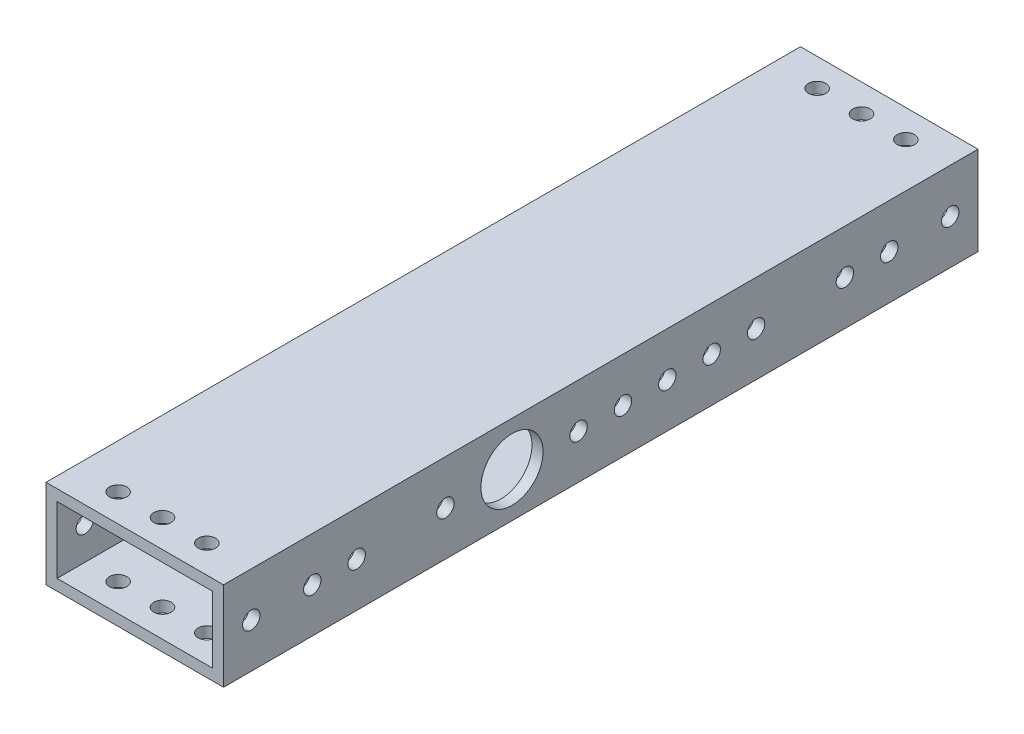
from build123d import *

# Parameters (mm, degrees)
SKETCH1_W           = 50.8
SKETCH1_H           = 25.4
SKETCH1_W_2         = 44.45
SKETCH1_H_2         = 19.05
BOSS_EXTRUDE1_DEPTH = 107.95
SKETCH3_R           = 2.4892
CUT_EXTRUDE2_DEPTH  = 114.769602707
SKETCH4_R           = 8.89
SKETCH4_R_2         = 2.4892
CUT_EXTRUDE3_DEPTH  = 120.979717036
SKETCH2_R           = 2.4892
CUT_EXTRUDE1_DEPTH  = 120.979717036
CUT_EXTRUDE4_REACH  = 115.77
SKETCH5_R           = 2.4892
CUT_EXTRUDE5_REACH  = 121.98
SKETCH7_R           = 2.4892


with BuildPart() as part:
    # Sketch1 → Boss-Extrude1 (new, symmetric)
    with BuildSketch(Plane.XY):
        Rectangle(SKETCH1_W, SKETCH1_H)
        Rectangle(SKETCH1_W_2, SKETCH1_H_2, mode=Mode.SUBTRACT)
    extrude(amount=BOSS_EXTRUDE1_DEPTH, both=True)

    # Sketch3 → Cut-Extrude2 (cut, through all)
    with BuildSketch(Plane(origin=(0, 12.7, 0), x_dir=(1, 0, 0), z_dir=(0, 1, 0))):
        with Locations((-12.7, -100.0125)):
            Circle(SKETCH3_R)
        with Locations((0, -100.0125)):
            Circle(SKETCH3_R)
        with Locations((12.7, -100.0125)):
            Circle(SKETCH3_R)
        with Locations((12.7, 100.0125)):
            Circle(SKETCH3_R)
        with Locations((0, 100.0125)):
            Circle(SKETCH3_R)
        with Locations((-12.7, 100.0125)):
            Circle(SKETCH3_R)
    extrude(amount=-CUT_EXTRUDE2_DEPTH, mode=Mode.SUBTRACT)

    # Sketch4 → Cut-Extrude3 (cut, through all)
    with BuildSketch(Plane(origin=(25.4, 0, 0), x_dir=(0, 0, -1), z_dir=(1, 0, 0))):
        with Locations((-25.4, 0)):
            Circle(SKETCH4_R)
        with Locations((31.75, 0)):
            Circle(SKETCH4_R_2)
        with Locations((19.05, 0)):
            Circle(SKETCH4_R_2)
    extrude(amount=-CUT_EXTRUDE3_DEPTH, mode=Mode.SUBTRACT)

    # Sketch2 → Cut-Extrude1 (cut, through all)
    with BuildSketch(Plane(origin=(25.4, 0, 0), x_dir=(0, 0, -1), z_dir=(1, 0, 0))):
        with Locations((-100.0125, 0)):
            Circle(SKETCH2_R)
        with Locations((100.0125, 0)):
            Circle(SKETCH2_R)
        with Locations((-82.55, 0)):
            Circle(SKETCH2_R)
        with Locations((-69.85, 0)):
            Circle(SKETCH2_R)
        with Locations((69.85, 0)):
            Circle(SKETCH2_R)
        with Locations((82.55, 0)):
            Circle(SKETCH2_R)
    extrude(amount=-CUT_EXTRUDE1_DEPTH, mode=Mode.SUBTRACT)

    # Sketch5 → Cut-Extrude4 (cut, up to next)
    with BuildSketch(Plane.XZ.offset(12.7), mode=Mode.PRIVATE) as cut_extrude4_sk1:
        with Locations((-3.81, 69.85)):
            Circle(SKETCH5_R)
    cut_extrude4_tool1 = extrude(cut_extrude4_sk1.sketch, amount=-CUT_EXTRUDE4_REACH, mode=Mode.PRIVATE) & part.part
    # Sketch5 → Cut-Extrude4 (cut, up to next)
    with BuildSketch(Plane.XZ.offset(12.7), mode=Mode.PRIVATE) as cut_extrude4_sk2:
        with Locations((-16.51, 69.85)):
            Circle(SKETCH5_R)
    cut_extrude4_tool2 = extrude(cut_extrude4_sk2.sketch, amount=-CUT_EXTRUDE4_REACH, mode=Mode.PRIVATE) & part.part
    # Sketch5 → Cut-Extrude4 (cut, up to next)
    with BuildSketch(Plane.XZ.offset(12.7), mode=Mode.PRIVATE) as cut_extrude4_sk3:
        with Locations((-16.51, 57.15)):
            Circle(SKETCH5_R)
    cut_extrude4_tool3 = extrude(cut_extrude4_sk3.sketch, amount=-CUT_EXTRUDE4_REACH, mode=Mode.PRIVATE) & part.part
    # Sketch5 → Cut-Extrude4 (cut, up to next)
    with BuildSketch(Plane.XZ.offset(12.7), mode=Mode.PRIVATE) as cut_extrude4_sk4:
        with Locations((-3.81, 57.15)):
            Circle(SKETCH5_R)
    cut_extrude4_tool4 = extrude(cut_extrude4_sk4.sketch, amount=-CUT_EXTRUDE4_REACH, mode=Mode.PRIVATE) & part.part
    # Sketch5 → Cut-Extrude4 (cut, up to next)
    with BuildSketch(Plane.XZ.offset(12.7), mode=Mode.PRIVATE) as cut_extrude4_sk5:
        with Locations((-3.81, -6.35)):
            Circle(SKETCH5_R)
    cut_extrude4_tool5 = extrude(cut_extrude4_sk5.sketch, amount=-CUT_EXTRUDE4_REACH, mode=Mode.PRIVATE) & part.part
    # Sketch5 → Cut-Extrude4 (cut, up to next)
    with BuildSketch(Plane.XZ.offset(12.7), mode=Mode.PRIVATE) as cut_extrude4_sk6:
        with Locations((-16.51, -6.35)):
            Circle(SKETCH5_R)
    cut_extrude4_tool6 = extrude(cut_extrude4_sk6.sketch, amount=-CUT_EXTRUDE4_REACH, mode=Mode.PRIVATE) & part.part
    # Sketch5 → Cut-Extrude4 (cut, up to next)
    with BuildSketch(Plane.XZ.offset(12.7), mode=Mode.PRIVATE) as cut_extrude4_sk7:
        with Locations((-16.51, -19.05)):
            Circle(SKETCH5_R)
    cut_extrude4_tool7 = extrude(cut_extrude4_sk7.sketch, amount=-CUT_EXTRUDE4_REACH, mode=Mode.PRIVATE) & part.part
    # Sketch5 → Cut-Extrude4 (cut, up to next)
    with BuildSketch(Plane.XZ.offset(12.7), mode=Mode.PRIVATE) as cut_extrude4_sk8:
        with Locations((-3.81, -19.05)):
            Circle(SKETCH5_R)
    cut_extrude4_tool8 = extrude(cut_extrude4_sk8.sketch, amount=-CUT_EXTRUDE4_REACH, mode=Mode.PRIVATE) & part.part
    add(cut_extrude4_tool1.solids().sort_by_distance((-3.81, -12.7, 69.85))[0], mode=Mode.SUBTRACT)
    add(cut_extrude4_tool2.solids().sort_by_distance((-16.51, -12.7, 69.85))[0], mode=Mode.SUBTRACT)
    add(cut_extrude4_tool3.solids().sort_by_distance((-16.51, -12.7, 57.15))[0], mode=Mode.SUBTRACT)
    add(cut_extrude4_tool4.solids().sort_by_distance((-3.81, -12.7, 57.15))[0], mode=Mode.SUBTRACT)
    add(cut_extrude4_tool5.solids().sort_by_distance((-3.81, -12.7, -6.35))[0], mode=Mode.SUBTRACT)
    add(cut_extrude4_tool6.solids().sort_by_distance((-16.51, -12.7, -6.35))[0], mode=Mode.SUBTRACT)
    add(cut_extrude4_tool7.solids().sort_by_distance((-16.51, -12.7, -19.05))[0], mode=Mode.SUBTRACT)
    add(cut_extrude4_tool8.solids().sort_by_distance((-3.81, -12.7, -19.05))[0], mode=Mode.SUBTRACT)

    # Sketch7 → Cut-Extrude5 (cut, up to next)
    with BuildSketch(Plane(origin=(25.4, 0, 0), x_dir=(0, 0, -1), z_dir=(1, 0, 0)), mode=Mode.PRIVATE) as cut_extrude5_sk1:
        with Locations((44.45, 0)):
            Circle(SKETCH7_R)
    cut_extrude5_tool1 = extrude(cut_extrude5_sk1.sketch, amount=-CUT_EXTRUDE5_REACH, mode=Mode.PRIVATE) & part.part
    # Sketch7 → Cut-Extrude5 (cut, up to next)
    with BuildSketch(Plane(origin=(25.4, 0, 0), x_dir=(0, 0, -1), z_dir=(1, 0, 0)), mode=Mode.PRIVATE) as cut_extrude5_sk2:
        with Locations((6.35, 0)):
            Circle(SKETCH7_R)
    cut_extrude5_tool2 = extrude(cut_extrude5_sk2.sketch, amount=-CUT_EXTRUDE5_REACH, mode=Mode.PRIVATE) & part.part
    # Sketch7 → Cut-Extrude5 (cut, up to next)
    with BuildSketch(Plane(origin=(25.4, 0, 0), x_dir=(0, 0, -1), z_dir=(1, 0, 0)), mode=Mode.PRIVATE) as cut_extrude5_sk3:
        with Locations((-6.35, 0)):
            Circle(SKETCH7_R)
    cut_extrude5_tool3 = extrude(cut_extrude5_sk3.sketch, amount=-CUT_EXTRUDE5_REACH, mode=Mode.PRIVATE) & part.part
    # Sketch7 → Cut-Extrude5 (cut, up to next)
    with BuildSketch(Plane(origin=(25.4, 0, 0), x_dir=(0, 0, -1), z_dir=(1, 0, 0)), mode=Mode.PRIVATE) as cut_extrude5_sk4:
        with Locations((-44.45, 0)):
            Circle(SKETCH7_R)
    cut_extrude5_tool4 = extrude(cut_extrude5_sk4.sketch, amount=-CUT_EXTRUDE5_REACH, mode=Mode.PRIVATE) & part.part
    add(cut_extrude5_tool1.solids().sort_by_distance((25.4, 0, -44.45))[0], mode=Mode.SUBTRACT)
    add(cut_extrude5_tool2.solids().sort_by_distance((25.4, 0, -6.35))[0], mode=Mode.SUBTRACT)
    add(cut_extrude5_tool3.solids().sort_by_distance((25.4, 0, 6.35))[0], mode=Mode.SUBTRACT)
    add(cut_extrude5_tool4.solids().sort_by_distance((25.4, 0, 44.45))[0], mode=Mode.SUBTRACT)


solid = part.part
